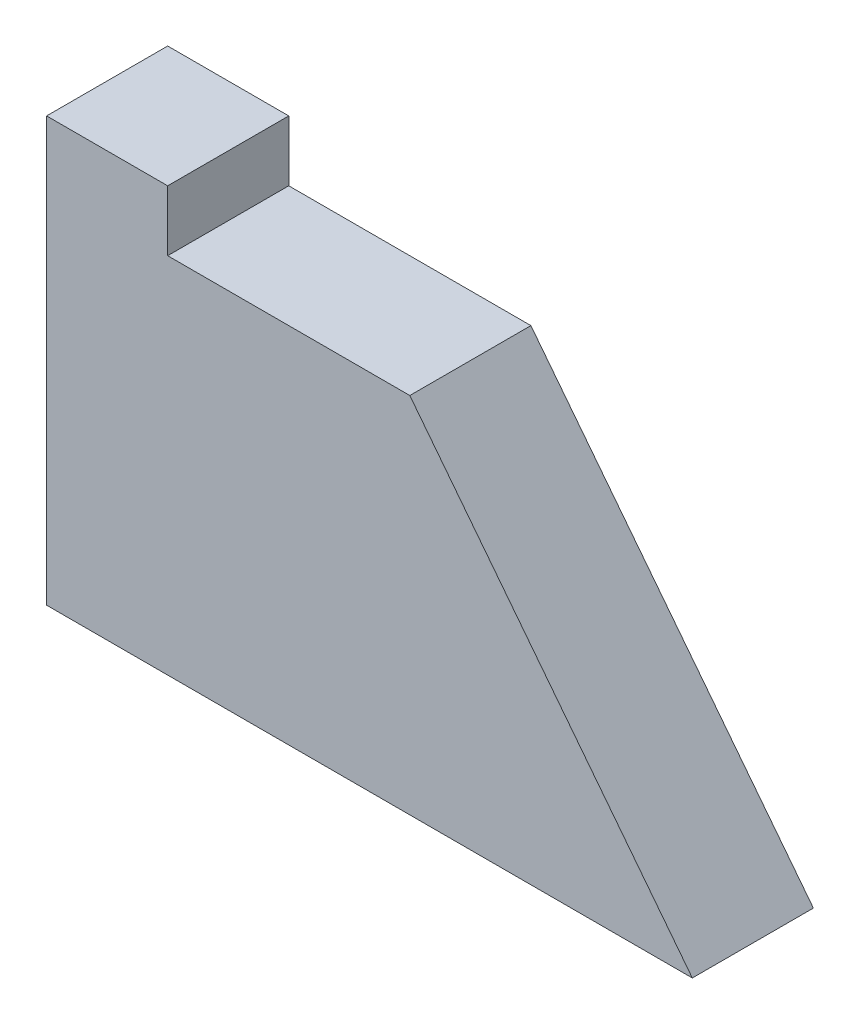
from build123d import *

# Parameters (mm, degrees)
EXTRUDE_1_DEPTH = 3
SKETCH_2_W      = 3
SKETCH_2_H      = 3
EXTRUDE_2_DEPTH = 1.5


with BuildPart() as part:
    # Эскиз1 → Бобышка-Вытянуть1 (new body)
    with BuildSketch(Plane.XY):
        Polygon((0, 9), (0, 0), (16, 0), (9, 9), align=None)
    extrude(amount=EXTRUDE_1_DEPTH)

    # Эскиз2 → Бобышка-Вытянуть2 (add)
    with BuildSketch(Plane(origin=(0, 9, 0), x_dir=(1, 0, 0), z_dir=(0, 1, 0))):
        with Locations((1.5, -1.5)):
            Rectangle(SKETCH_2_W, SKETCH_2_H)
    extrude(amount=EXTRUDE_2_DEPTH)


solid = part.part
